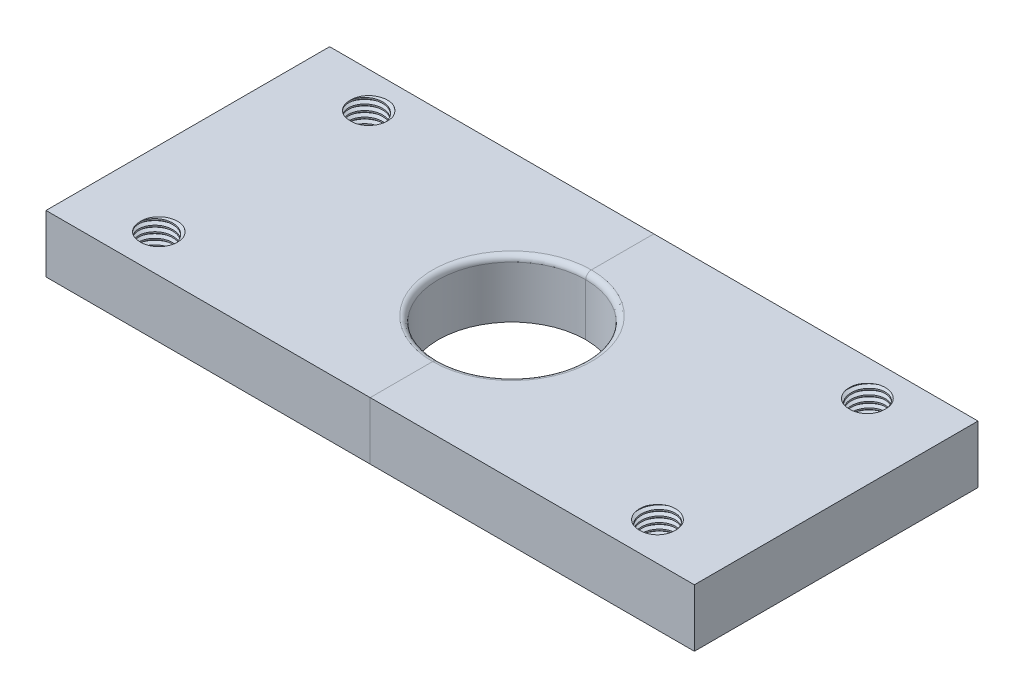
from build123d import *

# Parameters (mm, degrees)
CROQUIS2_R              = 3
SALIENTE_EXTRUIR1_DEPTH = 10.16
REDONDEO5_R             = 1
ROSCA3_PITCH            = 1
ROSCA1_PITCH            = 1


with BuildPart() as part:
    # Croquis2 → Saliente-Extruir1 (new body)
    with BuildSketch(Plane(origin=(0, 0, 0), x_dir=(1, 0, 0), z_dir=(0, 1, 0))):
        with BuildLine():
            Line((0, 25), (-57.15, 25))
            Line((-57.15, 25), (-57.15, -25))
            Line((-57.15, -25), (0, -25))
            Line((0, -25), (0, -13))
            ThreePointArc((0, -13), (-13, 0), (0, 13))
            Line((0, 13), (0, 25))
        make_face()
        with Locations(Location((-44.15, -18.5, 0), (0, 0, 270))):
            Circle(CROQUIS2_R, mode=Mode.SUBTRACT)
        with Locations(Location((-44.15, 18.5, 0), (0, 0, 270))):
            Circle(CROQUIS2_R, mode=Mode.SUBTRACT)
    extrude(amount=SALIENTE_EXTRUIR1_DEPTH)

    # Redondeo5
    redondeo5_edges = [part.edges().sort_by_distance(p)[0] for p in [
        (-13, 10.16, 0),
    ]]
    fillet(redondeo5_edges, radius=REDONDEO5_R)

    # Rosca3: the profile of Perfil de rosca3 profile screwed along a right-hand helix of 20 turns, 8 arcs to a turn; built about Z, then put on its axis
    rosca3_z = Axis((0, 0, 0), (0, 0, 1))
    rosca3_corners = [(2.9997, 0, -0.000173205), (3.541265875, 0, 0.312499998), (3.541265875, 0, 0.437499998), (2.9997, 0, 0.750173202)]
    with BuildLine(mode=Mode.PRIVATE) as rosca3_profile:
        Line(rosca3_corners[0], rosca3_corners[1])
        Line(rosca3_corners[1], rosca3_corners[2])
        Line(rosca3_corners[2], rosca3_corners[3])
        Line(rosca3_corners[3], rosca3_corners[0])
    rosca3_cap = Face(rosca3_profile.wire())
    rosca3_turn_angles = [0, 22.5, 45, 67.5, 90, 112.5, 135, 157.5, 180, 202.5, 225, 247.5, 270, 292.5, 315, 337.5, 360]
    rosca3_turn_weights = [1, 0.9238795325112867, 1, 0.9238795325112867, 1, 0.9238795325112867, 1, 0.9238795325112867, 1, 0.9238795325112867, 1, 0.9238795325112867, 1, 0.9238795325112867, 1, 0.9238795325112867, 1]
    rosca3_turn_rails = [Edge.make_bspline([Vector(p[0], p[1], 0).rotate(rosca3_z, rosca3_turn_angles[k]) / rosca3_turn_weights[k] + Vector(0, 0, p[2] + ROSCA3_PITCH * rosca3_turn_angles[k] / 360) for k in range(17)], [0, 0, 0, 1, 1, 2, 2, 3, 3, 4, 4, 5, 5, 6, 6, 7, 7, 8, 8, 8], 2, rosca3_turn_weights) for p in rosca3_corners]
    rosca3_turn_sides = [Face.make_surface_from_curves(rosca3_turn_rails[p[0]], rosca3_turn_rails[p[1]]) for p in [(0, 1), (1, 2), (2, 3), (3, 0)]]
    rosca3 = Plane(origin=(-44.15, 10.909999997, -18.5), x_dir=(-1, 0, 0), z_dir=(0, -1, 0)) * Solid(Shell([*[p.moved(Location((0, 0, ROSCA3_PITCH * i))) for i in range(20) for p in rosca3_turn_sides], rosca3_cap, rosca3_cap.rotate(rosca3_z, 7200).moved(Location((0, 0, ROSCA3_PITCH * 7200 / 360)))]))
    add(rosca3, mode=Mode.SUBTRACT)

    # Rosca1: the profile of Perfil de rosca1 profile screwed along a right-hand helix of 20 turns, 8 arcs to a turn; built about Z, then put on its axis
    rosca1_z = Axis((0, 0, 0), (0, 0, 1))
    rosca1_corners = [(2.9997, 0, -0.000173205), (3.541265875, 0, 0.312499998), (3.541265875, 0, 0.437499998), (2.9997, 0, 0.750173202)]
    with BuildLine(mode=Mode.PRIVATE) as rosca1_profile:
        Line(rosca1_corners[0], rosca1_corners[1])
        Line(rosca1_corners[1], rosca1_corners[2])
        Line(rosca1_corners[2], rosca1_corners[3])
        Line(rosca1_corners[3], rosca1_corners[0])
    rosca1_cap = Face(rosca1_profile.wire())
    rosca1_turn_angles = [0, 22.5, 45, 67.5, 90, 112.5, 135, 157.5, 180, 202.5, 225, 247.5, 270, 292.5, 315, 337.5, 360]
    rosca1_turn_weights = [1, 0.9238795325112867, 1, 0.9238795325112867, 1, 0.9238795325112867, 1, 0.9238795325112867, 1, 0.9238795325112867, 1, 0.9238795325112867, 1, 0.9238795325112867, 1, 0.9238795325112867, 1]
    rosca1_turn_rails = [Edge.make_bspline([Vector(p[0], p[1], 0).rotate(rosca1_z, rosca1_turn_angles[k]) / rosca1_turn_weights[k] + Vector(0, 0, p[2] + ROSCA1_PITCH * rosca1_turn_angles[k] / 360) for k in range(17)], [0, 0, 0, 1, 1, 2, 2, 3, 3, 4, 4, 5, 5, 6, 6, 7, 7, 8, 8, 8], 2, rosca1_turn_weights) for p in rosca1_corners]
    rosca1_turn_sides = [Face.make_surface_from_curves(rosca1_turn_rails[p[0]], rosca1_turn_rails[p[1]]) for p in [(0, 1), (1, 2), (2, 3), (3, 0)]]
    rosca1 = Plane(origin=(-44.15, 10.909999997, 18.5), x_dir=(-1, 0, 0), z_dir=(0, -1, 0)) * Solid(Shell([*[p.moved(Location((0, 0, ROSCA1_PITCH * i))) for i in range(20) for p in rosca1_turn_sides], rosca1_cap, rosca1_cap.rotate(rosca1_z, 7200).moved(Location((0, 0, ROSCA1_PITCH * 7200 / 360)))]))
    add(rosca1, mode=Mode.SUBTRACT)


with BuildPart() as body_2:
    # Simetría2: mirrored copy
    add(part.part.mirror(Plane(origin=(0, 0, 0), x_dir=(0, 0, 1), z_dir=(1, 0, 0))))


solid = Compound([part.part, body_2.part])
